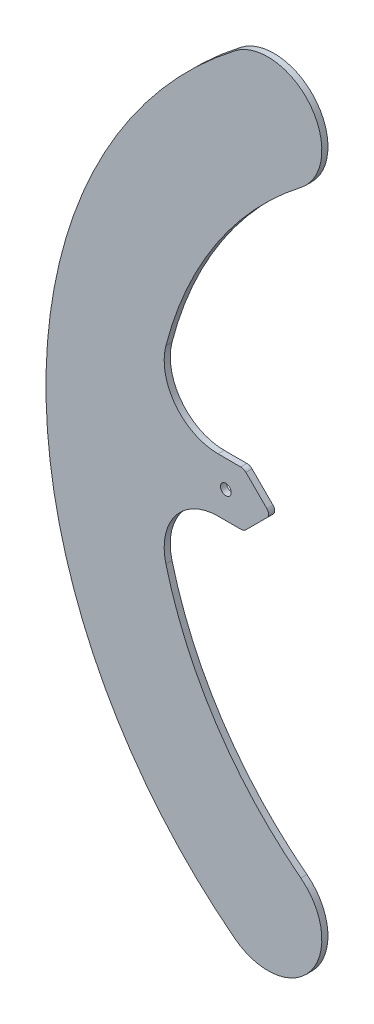
from build123d import *

# Parameters (mm, degrees)
SKETCH1_R           = 1.5
BOSS_EXTRUDE1_DEPTH = 1.7
FILLET1_R           = 15
FILLET2_R           = 2


with BuildPart() as part:
    # Sketch1 → Boss-Extrude1 (new body)
    with BuildSketch(Plane.XY):
        with BuildLine():
            ThreePointArc((-11.978690547, -106.87499991), (9.060608653, -104.164298748), (6.349906949, -83.124999619))
            ThreePointArc((6.349906949, -83.124999619), (-22.020584843, -49.648176002), (-34.231800328, -7.5))
            Line((-34.231800328, -7.5), (-9.5, -7.5))
            Line((-9.5, -7.5), (-3.060660172, -1.060660172))
            ThreePointArc((-3.060660172, -1.060660172), (-2.621320344, 0), (-3.060660172, 1.060660172))
            Line((-3.060660172, 1.060660172), (-9.5, 7.5))
            Line((-9.5, 7.5), (-34.231800328, 7.5))
            ThreePointArc((-34.231800328, 7.5), (-22.020584884, 49.648175925), (6.349906811, 83.124999512))
            ThreePointArc((6.349906811, 83.124999512), (9.060608694, 104.164298694), (-11.978690577, 106.874999887))
            ThreePointArc((-11.978690577, 106.874999887), (-64.5, -1.9e-08), (-11.978690547, -106.87499991))
        make_face()
        with Locations((-14.5, 0)):
            Circle(SKETCH1_R, mode=Mode.SUBTRACT)
    extrude(amount=BOSS_EXTRUDE1_DEPTH)

    # Fillet1
    fillet1_edges = [part.edges().sort_by_distance(p)[0] for p in [
        (-34.231800328, -7.5, 0.85),
        (-34.231800328, 7.5, 0.85),
    ]]
    fillet(fillet1_edges, radius=FILLET1_R)

    # Fillet2
    fillet2_edges = [part.edges().sort_by_distance(p)[0] for p in [
        (-9.5, -7.5, 0.85),
        (-9.5, 7.5, 0.85),
    ]]
    fillet(fillet2_edges, radius=FILLET2_R)


solid = part.part
